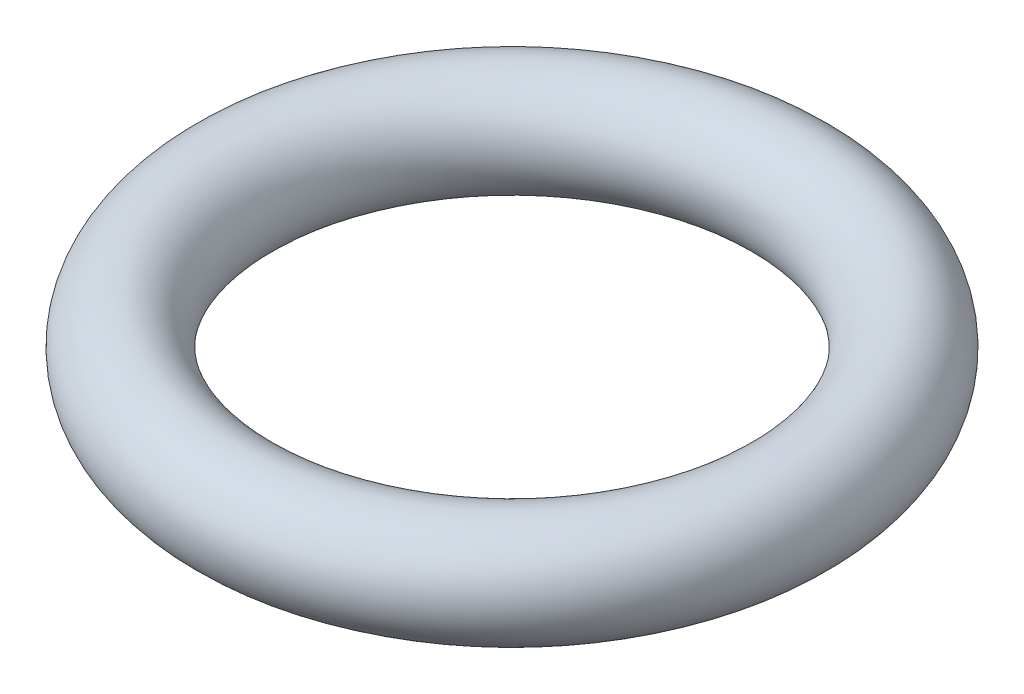
from build123d import *

# Parameters (mm, degrees)
SKETCH1_R = 1.190625


with BuildPart() as part:
    # Sketch1 → BASE SHAPE (revolve)
    with BuildSketch(Plane.XY):
        with Locations((6.270625, 0)):
            Circle(SKETCH1_R)
    revolve(axis=Axis((0, 0.254, 0), (0, -1, 0)))


solid = part.part
